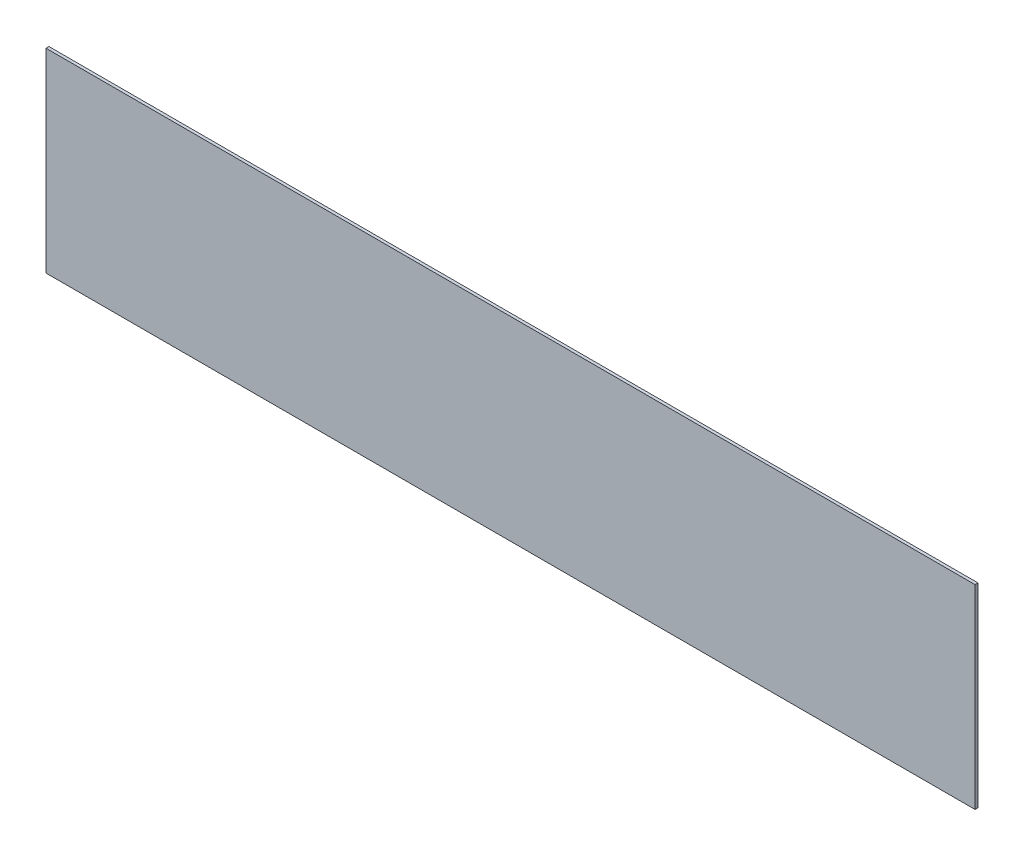
from build123d import *

# Parameters (mm, degrees)
SKETCH2_W           = 1003.3
SKETCH2_H           = 210.312
BOSS_EXTRUDE1_DEPTH = 3.175


with BuildPart() as part:
    # Sketch2 → Boss-Extrude1 (new body)
    with BuildSketch(Plane.XY):
        with Locations((501.65, 105.156)):
            Rectangle(SKETCH2_W, SKETCH2_H)
    extrude(amount=BOSS_EXTRUDE1_DEPTH)


solid = part.part
